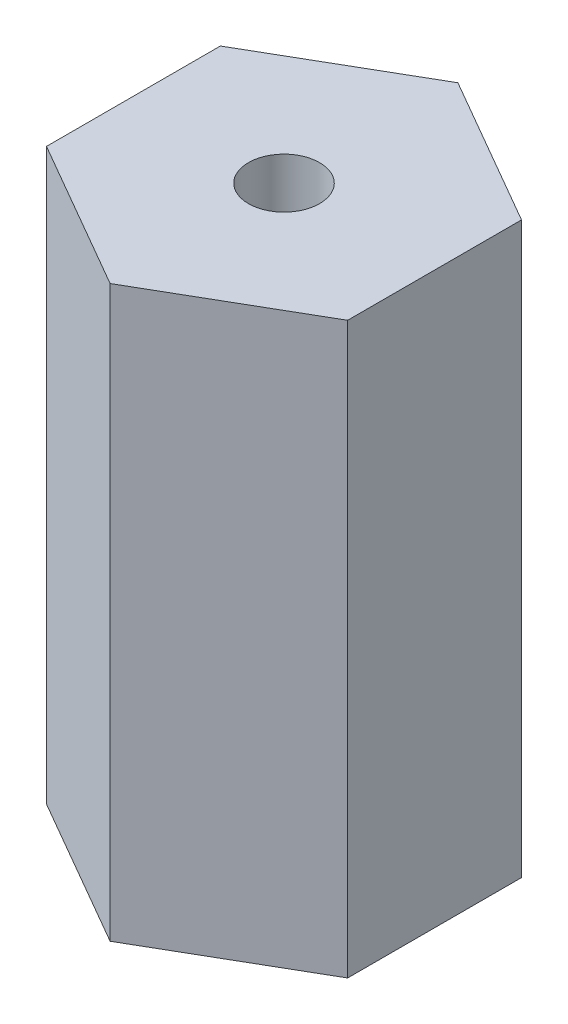
from build123d import *

# Parameters (mm, degrees)
SKETCH1_R           = 1.5
BOSS_EXTRUDE1_DEPTH = 24.0204498
SKETCH2_R           = 5
CUT_EXTRUDE1_DEPTH  = 2.54


with BuildPart() as part:
    # Sketch1 → Boss-Extrude1 (new body)
    with BuildSketch(Plane(origin=(0, 0, 0), x_dir=(1, 0, 0), z_dir=(0, 1, 0))):
        Polygon((0, 7.332348419), (-6.35, 3.666174209), (-6.35, -3.666174209), (0, -7.332348419), (6.35, -3.666174209), (6.35, 3.666174209), align=None)
        Circle(SKETCH1_R, mode=Mode.SUBTRACT)
    extrude(amount=BOSS_EXTRUDE1_DEPTH)

    # Sketch2 → Cut-Extrude1 (cut)
    with BuildSketch(Plane(origin=(0, 0, 0), x_dir=(1, 0, 0), z_dir=(0, 1, 0))):
        Circle(SKETCH2_R)
    extrude(amount=CUT_EXTRUDE1_DEPTH, mode=Mode.SUBTRACT)


solid = part.part
